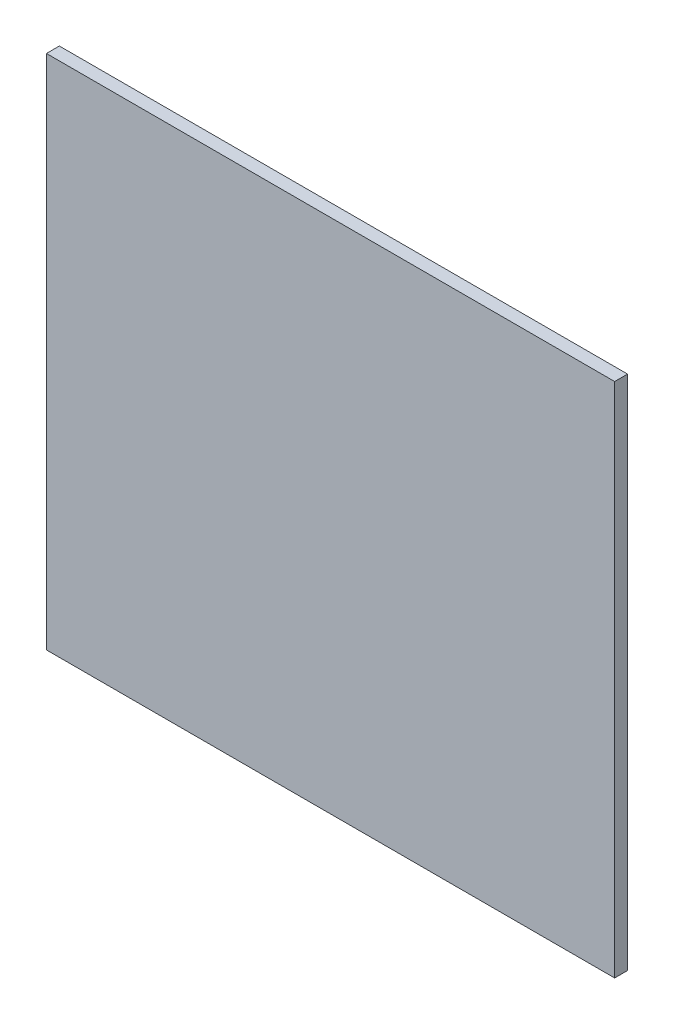
from build123d import *

# Parameters (mm, degrees)
SKETCH1_W           = 139.7
SKETCH1_H           = 127
BOSS_EXTRUDE1_DEPTH = 3.175


with BuildPart() as part:
    # Sketch1 → Boss-Extrude1 (new body)
    with BuildSketch(Plane.XY):
        Rectangle(SKETCH1_W, SKETCH1_H)
    extrude(amount=BOSS_EXTRUDE1_DEPTH)


solid = part.part
